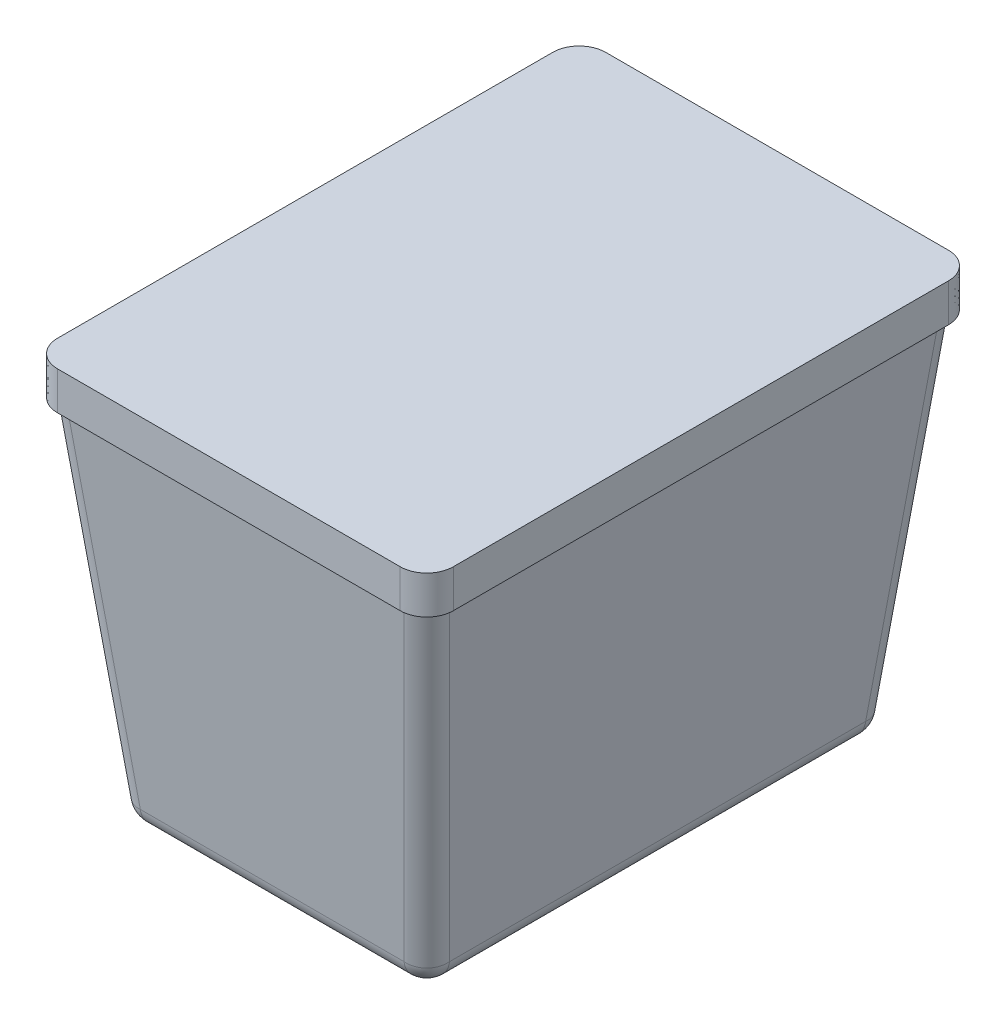
from build123d import *

# Parameters (mm, degrees)
CROQUIS1_W     = 400
CROQUIS1_H     = 600
EXTRUIR1_DEPTH = 520
EXTRUIR1_DRAFT = -6
REDONDEO1_R    = 30
VACIADO1_T     = -10
EXTRUIR2_DEPTH = 40
EXTRUIR3_DEPTH = 10


with BuildPart() as part:
    # Croquis1 → Extruir1 (with draft: the straight prism first)
    with BuildSketch(Plane(origin=(0, 0, 0), x_dir=(1, 0, 0), z_dir=(0, 1, 0))):
        Rectangle(CROQUIS1_W, CROQUIS1_H)
    extrude(amount=EXTRUIR1_DEPTH)
    # Extruir1: the draft: its side faces are tilted about the plane it starts from
    extruir1_sides = [part.faces().sort_by_distance(p)[0] for p in [
        (200, 260, 0),
        (0, 260, -300),
        (-200, 260, 0),
        (0, 260, 300),
    ]]
    draft(extruir1_sides, Plane(origin=(0, 0, 0), x_dir=(1, 0, 0), z_dir=(0, 1, 0)), EXTRUIR1_DRAFT)

    # Redondeo1
    redondeo1_edges = [part.edges().sort_by_distance(p)[0] for p in [
        (0, 0, 300),
        (200, 0, 0),
        (0, 0, -300),
        (-200, 0, 0),
        (-227.327101169, 260, -327.327101169),
        (227.327101169, 260, -327.327101169),
        (227.327101169, 260, 327.327101169),
        (-227.327101169, 260, 327.327101169),
    ]]
    fillet(redondeo1_edges, radius=REDONDEO1_R)

    # Vaciado1
    vaciado1_openings = [part.faces().sort_by_distance(p)[0] for p in [
        (0, 520, 0),
    ]]
    offset(amount=VACIADO1_T, openings=vaciado1_openings, kind=Kind.INTERSECTION)


with BuildPart() as body_2:
    # Croquis2 → Extruir2 (new body)
    with BuildSketch(Plane(origin=(0, 520, 0), x_dir=(1, 0, 0), z_dir=(0, 1, 0))):
        with BuildLine():
            Line((224.818545477, 359.654202338), (-224.818545477, 359.654202338))
            add(Edge.make_bspline(
                [(-224.818545477, 359.654202338), (-227.120086028, 359.654202338), (-229.380934681, 359.430411757), (-232.713747218, 358.773214804), (-233.814869933, 358.500171352), (-235.451518922, 358.007918705), (-235.994558337, 357.830029047), (-237.075507941, 357.446040848), (-237.613820315, 357.239674494), (-240.2615232, 356.148907719), (-242.265343116, 355.081190983), (-245.10317609, 353.193132085), (-246.020940364, 352.51569528), (-247.353923908, 351.425037779), (-247.790551127, 351.049250723), (-248.639460703, 350.281234378), (-249.053000136, 349.888002267), (-251.066995309, 347.87646125), (-252.507863424, 346.123294027), (-254.41183532, 343.276088185), (-255.005828534, 342.285067005), (-256.083159903, 340.267175368), (-256.568789235, 339.23798924), (-257.870403065, 336.091173443), (-258.532675254, 333.914517133), (-259.430368248, 329.399769105), (-259.654202338, 327.120197811), (-259.654202338, 324.818545477)],
                knots=[0, 0, 0, 0, 0.125, 0.125, 0.1875, 0.1875, 0.21875, 0.21875, 0.25, 0.25, 0.375, 0.375, 0.4375, 0.4375, 0.46875, 0.46875, 0.5, 0.5, 0.625, 0.625, 0.6875, 0.6875, 0.75, 0.75, 0.875, 0.875, 1, 1, 1, 1], degree=3))
            Line((-259.654202338, 324.818545477), (-259.654202338, -324.818545477))
            add(Edge.make_bspline(
                [(-259.654202338, -324.818545477), (-259.654202338, -327.120086028), (-259.430411757, -329.380934681), (-258.773214804, -332.713747218), (-258.500171352, -333.814869933), (-258.007918705, -335.451518922), (-257.830029047, -335.994558337), (-257.446040848, -337.075507941), (-257.239674494, -337.613820315), (-256.148907719, -340.2615232), (-255.081190983, -342.265343116), (-253.193132085, -345.10317609), (-252.51569528, -346.020940364), (-251.425037779, -347.353923908), (-251.049250723, -347.790551127), (-250.281234378, -348.639460703), (-249.888002267, -349.053000136), (-247.87646125, -351.066995309), (-246.123294027, -352.507863424), (-243.276088185, -354.41183532), (-242.285067005, -355.005828534), (-240.267175368, -356.083159903), (-239.23798924, -356.568789235), (-236.091173443, -357.870403065), (-233.914517133, -358.532675254), (-229.399769105, -359.430368248), (-227.120197811, -359.654202338), (-224.818545477, -359.654202338)],
                knots=[0, 0, 0, 0, 0.125, 0.125, 0.1875, 0.1875, 0.21875, 0.21875, 0.25, 0.25, 0.375, 0.375, 0.4375, 0.4375, 0.46875, 0.46875, 0.5, 0.5, 0.625, 0.625, 0.6875, 0.6875, 0.75, 0.75, 0.875, 0.875, 1, 1, 1, 1], degree=3))
            Line((-224.818545477, -359.654202338), (224.818545477, -359.654202338))
            add(Edge.make_bspline(
                [(224.818545477, -359.654202338), (227.120086028, -359.654202338), (229.380934681, -359.430411757), (232.713747218, -358.773214804), (233.814869933, -358.500171352), (235.451518922, -358.007918705), (235.994558337, -357.830029047), (237.075507941, -357.446040848), (237.613820315, -357.239674494), (240.2615232, -356.148907719), (242.265343116, -355.081190983), (245.10317609, -353.193132085), (246.020940364, -352.51569528), (247.353923908, -351.425037779), (247.790551127, -351.049250723), (248.639460703, -350.281234378), (249.053000136, -349.888002267), (251.066995309, -347.87646125), (252.507863424, -346.123294027), (254.41183532, -343.276088185), (255.005828534, -342.285067005), (256.083159903, -340.267175368), (256.568789235, -339.23798924), (257.870403065, -336.091173443), (258.532675254, -333.914517133), (259.430368248, -329.399769105), (259.654202338, -327.120197811), (259.654202338, -324.818545477)],
                knots=[0, 0, 0, 0, 0.125, 0.125, 0.1875, 0.1875, 0.21875, 0.21875, 0.25, 0.25, 0.375, 0.375, 0.4375, 0.4375, 0.46875, 0.46875, 0.5, 0.5, 0.625, 0.625, 0.6875, 0.6875, 0.75, 0.75, 0.875, 0.875, 1, 1, 1, 1], degree=3))
            Line((259.654202338, -324.818545477), (259.654202338, 324.818545477))
            add(Edge.make_bspline(
                [(259.654202338, 324.818545477), (259.654202338, 327.120086028), (259.430411757, 329.380934681), (258.773214804, 332.713747218), (258.500171352, 333.814869933), (258.007918705, 335.451518922), (257.830029047, 335.994558337), (257.446040848, 337.075507941), (257.239674494, 337.613820315), (256.148907719, 340.2615232), (255.081190983, 342.265343116), (253.193132085, 345.10317609), (252.51569528, 346.020940364), (251.425037779, 347.353923908), (251.049250723, 347.790551127), (250.281234378, 348.639460703), (249.888002267, 349.053000136), (247.87646125, 351.066995309), (246.123294027, 352.507863424), (243.276088185, 354.41183532), (242.285067005, 355.005828534), (240.267175368, 356.083159903), (239.23798924, 356.568789235), (236.091173443, 357.870403065), (233.914517133, 358.532675254), (229.399769105, 359.430368248), (227.120197811, 359.654202338), (224.818545477, 359.654202338)],
                knots=[0, 0, 0, 0, 0.125, 0.125, 0.1875, 0.1875, 0.21875, 0.21875, 0.25, 0.25, 0.375, 0.375, 0.4375, 0.4375, 0.46875, 0.46875, 0.5, 0.5, 0.625, 0.625, 0.6875, 0.6875, 0.75, 0.75, 0.875, 0.875, 1, 1, 1, 1], degree=3))
        make_face()
    extrude(amount=-EXTRUIR2_DEPTH)

    # Croquis3 → Extruir3 (add)
    with BuildSketch(Plane(origin=(0, 520, 0), x_dir=(1, 0, 0), z_dir=(0, 1, 0))):
        with BuildLine():
            Line((-259.654202338, 324.818545477), (-259.654202338, -324.818545477))
            add(Edge.make_bspline(
                [(-259.654202338, -324.818545477), (-259.654202338, -327.120086028), (-259.430411757, -329.380934681), (-258.773214804, -332.713747218), (-258.500171352, -333.814869933), (-258.007918705, -335.451518922), (-257.830029047, -335.994558337), (-257.446040848, -337.075507941), (-257.239674494, -337.613820315), (-256.148907719, -340.2615232), (-255.081190983, -342.265343116), (-253.193132085, -345.10317609), (-252.51569528, -346.020940364), (-251.425037779, -347.353923908), (-251.049250723, -347.790551127), (-250.281234378, -348.639460703), (-249.888002267, -349.053000136), (-247.87646125, -351.066995309), (-246.123294027, -352.507863424), (-243.276088185, -354.41183532), (-242.285067005, -355.005828534), (-240.267175368, -356.083159903), (-239.23798924, -356.568789235), (-236.091173443, -357.870403065), (-233.914517133, -358.532675254), (-229.399769105, -359.430368248), (-227.120197811, -359.654202338), (-224.818545477, -359.654202338)],
                knots=[0, 0, 0, 0, 0.125, 0.125, 0.1875, 0.1875, 0.21875, 0.21875, 0.25, 0.25, 0.375, 0.375, 0.4375, 0.4375, 0.46875, 0.46875, 0.5, 0.5, 0.625, 0.625, 0.6875, 0.6875, 0.75, 0.75, 0.875, 0.875, 1, 1, 1, 1], degree=3))
            Line((-224.818545477, -359.654202338), (224.818545477, -359.654202338))
            add(Edge.make_bspline(
                [(224.818545477, -359.654202338), (227.120086028, -359.654202338), (229.380934681, -359.430411757), (232.713747218, -358.773214804), (233.814869933, -358.500171352), (235.451518922, -358.007918705), (235.994558337, -357.830029047), (237.075507941, -357.446040848), (237.613820315, -357.239674494), (240.2615232, -356.148907719), (242.265343116, -355.081190983), (245.10317609, -353.193132085), (246.020940364, -352.51569528), (247.353923908, -351.425037779), (247.790551127, -351.049250723), (248.639460703, -350.281234378), (249.053000136, -349.888002267), (251.066995309, -347.87646125), (252.507863424, -346.123294027), (254.41183532, -343.276088185), (255.005828534, -342.285067005), (256.083159903, -340.267175368), (256.568789235, -339.23798924), (257.870403065, -336.091173443), (258.532675254, -333.914517133), (259.430368248, -329.399769105), (259.654202338, -327.120197811), (259.654202338, -324.818545477)],
                knots=[0, 0, 0, 0, 0.125, 0.125, 0.1875, 0.1875, 0.21875, 0.21875, 0.25, 0.25, 0.375, 0.375, 0.4375, 0.4375, 0.46875, 0.46875, 0.5, 0.5, 0.625, 0.625, 0.6875, 0.6875, 0.75, 0.75, 0.875, 0.875, 1, 1, 1, 1], degree=3))
            Line((259.654202338, -324.818545477), (259.654202338, 324.818545477))
            add(Edge.make_bspline(
                [(259.654202338, 324.818545477), (259.654202338, 327.120086028), (259.430411757, 329.380934681), (258.773214804, 332.713747218), (258.500171352, 333.814869933), (258.007918705, 335.451518922), (257.830029047, 335.994558337), (257.446040848, 337.075507941), (257.239674494, 337.613820315), (256.148907719, 340.2615232), (255.081190983, 342.265343116), (253.193132085, 345.10317609), (252.51569528, 346.020940364), (251.425037779, 347.353923908), (251.049250723, 347.790551127), (250.281234378, 348.639460703), (249.888002267, 349.053000136), (247.87646125, 351.066995309), (246.123294027, 352.507863424), (243.276088185, 354.41183532), (242.285067005, 355.005828534), (240.267175368, 356.083159903), (239.23798924, 356.568789235), (236.091173443, 357.870403065), (233.914517133, 358.532675254), (229.399769105, 359.430368248), (227.120197811, 359.654202338), (224.818545477, 359.654202338)],
                knots=[0, 0, 0, 0, 0.125, 0.125, 0.1875, 0.1875, 0.21875, 0.21875, 0.25, 0.25, 0.375, 0.375, 0.4375, 0.4375, 0.46875, 0.46875, 0.5, 0.5, 0.625, 0.625, 0.6875, 0.6875, 0.75, 0.75, 0.875, 0.875, 1, 1, 1, 1], degree=3))
            Line((224.818545477, 359.654202338), (-224.818545477, 359.654202338))
            add(Edge.make_bspline(
                [(-224.818545477, 359.654202338), (-227.120086028, 359.654202338), (-229.380934681, 359.430411757), (-232.713747218, 358.773214804), (-233.814869933, 358.500171352), (-235.451518922, 358.007918705), (-235.994558337, 357.830029047), (-237.075507941, 357.446040848), (-237.613820315, 357.239674494), (-240.2615232, 356.148907719), (-242.265343116, 355.081190983), (-245.10317609, 353.193132085), (-246.020940364, 352.51569528), (-247.353923908, 351.425037779), (-247.790551127, 351.049250723), (-248.639460703, 350.281234378), (-249.053000136, 349.888002267), (-251.066995309, 347.87646125), (-252.507863424, 346.123294027), (-254.41183532, 343.276088185), (-255.005828534, 342.285067005), (-256.083159903, 340.267175368), (-256.568789235, 339.23798924), (-257.870403065, 336.091173443), (-258.532675254, 333.914517133), (-259.430368248, 329.399769105), (-259.654202338, 327.120197811), (-259.654202338, 324.818545477)],
                knots=[0, 0, 0, 0, 0.125, 0.125, 0.1875, 0.1875, 0.21875, 0.21875, 0.25, 0.25, 0.375, 0.375, 0.4375, 0.4375, 0.46875, 0.46875, 0.5, 0.5, 0.625, 0.625, 0.6875, 0.6875, 0.75, 0.75, 0.875, 0.875, 1, 1, 1, 1], degree=3))
        make_face()
    extrude(amount=EXTRUIR3_DEPTH)


solid = Compound([part.part, body_2.part])
